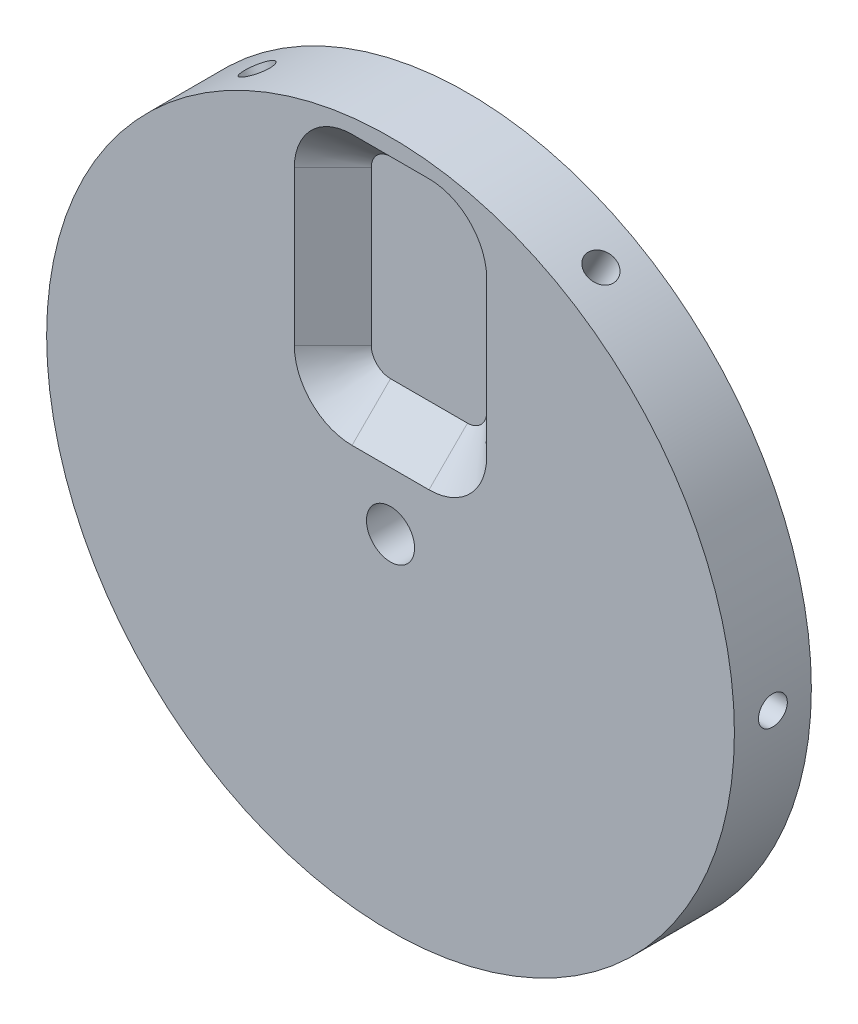
from build123d import *

# Parameters (mm, degrees)
SKETCH1_R           = 45.4025
BOSS_EXTRUDE1_DEPTH = 10.16
CUT_EXTRUDE1_START  = 38.1
SKETCH2_R           = 1.905
CUT_EXTRUDE1_DEPTH  = 7.62
CIRPATTERN1_COUNT   = 6
SKETCH3_R           = 3.175
CUT_EXTRUDE2_DEPTH  = 66.007689034
CUT_EXTRUDE3_DEPTH  = 5.08
CHAMFER2_SIZE       = 5.08


with BuildPart() as part:
    # Sketch1 → Boss-Extrude1 (new body)
    with BuildSketch(Plane.XY):
        Circle(SKETCH1_R)
    extrude(amount=BOSS_EXTRUDE1_DEPTH)

    # Sketch2 → Cut-Extrude1 (cut)
    with BuildSketch(Plane(origin=(0, 0, 0), x_dir=(0, 0, -1), z_dir=(1, 0, 0)).offset(CUT_EXTRUDE1_START)):
        with Locations((-5.08, 0)):
            Circle(SKETCH2_R)
    cut_extrude1 = extrude(amount=CUT_EXTRUDE1_DEPTH, mode=Mode.SUBTRACT)

    # CirPattern1: Cut-Extrude1 ×6 about axis
    cirpattern1_axis = Axis((0, 0, 0), (0, 0, 1))
    for i in range(1, CIRPATTERN1_COUNT):
        add(cut_extrude1.rotate(cirpattern1_axis, i * 360 / CIRPATTERN1_COUNT), mode=Mode.SUBTRACT)

    # Sketch3 → Cut-Extrude2 (cut, through all)
    with BuildSketch(Plane(origin=(0, 0, 0), x_dir=(-1, 0, 0), z_dir=(0, 0, -1))):
        Circle(SKETCH3_R)
    extrude(amount=-CUT_EXTRUDE2_DEPTH, mode=Mode.SUBTRACT)

    # Sketch4 → Cut-Extrude3 (cut)
    with BuildSketch(Plane.XY.offset(10.16)):
        with BuildLine():
            Line((-5.08, 38.1), (5.08, 38.1))
            ThreePointArc((5.08, 38.1), (6.876051224, 37.356051224), (7.62, 35.56))
            Line((7.62, 35.56), (7.62, 15.24))
            ThreePointArc((7.62, 15.24), (6.876051224, 13.443948776), (5.08, 12.7))
            Line((5.08, 12.7), (-5.08, 12.7))
            ThreePointArc((-5.08, 12.7), (-6.876051224, 13.443948776), (-7.62, 15.24))
            Line((-7.62, 15.24), (-7.62, 35.56))
            ThreePointArc((-7.62, 35.56), (-6.876051224, 37.356051224), (-5.08, 38.1))
        make_face()
    extrude(amount=-CUT_EXTRUDE3_DEPTH, mode=Mode.SUBTRACT)

    # Chamfer2
    chamfer2_edges = [part.edges().sort_by_distance(p)[0] for p in [
        (0, 12.7, 10.16),
        (6.876051224, 13.443948776, 10.16),
        (-6.876051224, 13.443948776, 10.16),
        (7.62, 25.4, 10.16),
        (-7.62, 25.4, 10.16),
        (6.876051224, 37.356051224, 10.16),
        (-6.876051224, 37.356051224, 10.16),
        (0, 38.1, 10.16),
    ]]
    chamfer(chamfer2_edges, length=CHAMFER2_SIZE - 0.0001)  # a hair under: the kernel refuses the full size


solid = part.part
